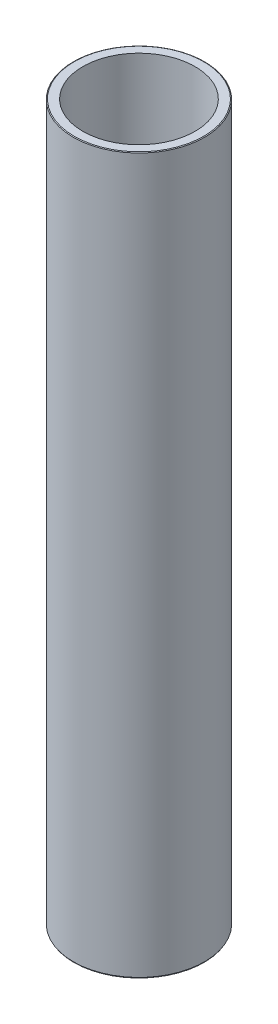
from build123d import *
from OCP.BRepFilletAPI import BRepFilletAPI_MakeChamfer

# Parameters (mm, degrees)
SKETCH1_R           = 55
BOSS_EXTRUDE1_DEPTH = 600
SKETCH2_R           = 47.090016809
CUT_EXTRUDE1_DEPTH  = 606.020660804
CHAMFER1_SIZE       = 0.414713746
CHAMFER1_SIZE2      = 0.718305278


with BuildPart() as part:
    # Sketch1 → Boss-Extrude1 (new body)
    with BuildSketch(Plane(origin=(0, 0, 0), x_dir=(1, 0, 0), z_dir=(0, 1, 0))):
        Circle(SKETCH1_R)
    extrude(amount=BOSS_EXTRUDE1_DEPTH)

    # Sketch2 → Cut-Extrude1 (cut, through all)
    with BuildSketch(Plane(origin=(0, 0, 0), x_dir=(1, 0, 0), z_dir=(0, 1, 0))):
        Circle(SKETCH2_R)
    extrude(amount=CUT_EXTRUDE1_DEPTH, mode=Mode.SUBTRACT)

    # Chamfer1: one chamfer whose edges measure the first distance from different faces: ONE call of the kernel's chamfer builder (chamfer() names one face for all edges)
    chamfer1_edges_1 = [part.edges().sort_by_distance(p)[0] for p in [
        (-55, 600, 0),
    ]]
    chamfer1_side_1 = [part.faces().sort_by_distance(p)[0] for p in [
        (-55, 300, 0),
    ]]
    chamfer1_edges_2 = [part.edges().sort_by_distance(p)[0] for p in [
        (-55, 0, 0),
    ]]
    chamfer1_side_2 = [part.faces().sort_by_distance(p)[0] for p in [
        (-53.444365081, 0, 0),
    ]]
    chamfer1 = BRepFilletAPI_MakeChamfer(part.part.solid().wrapped)
    for e in chamfer1_edges_1:
        chamfer1.Add(CHAMFER1_SIZE, CHAMFER1_SIZE2, e.wrapped, chamfer1_side_1[0].wrapped)  # the first distance lies on this face
    for e in chamfer1_edges_2:
        chamfer1.Add(CHAMFER1_SIZE, CHAMFER1_SIZE2, e.wrapped, chamfer1_side_2[0].wrapped)  # the first distance lies on this face
    add(Compound.cast(chamfer1.Shape()), mode=Mode.REPLACE)


solid = part.part
